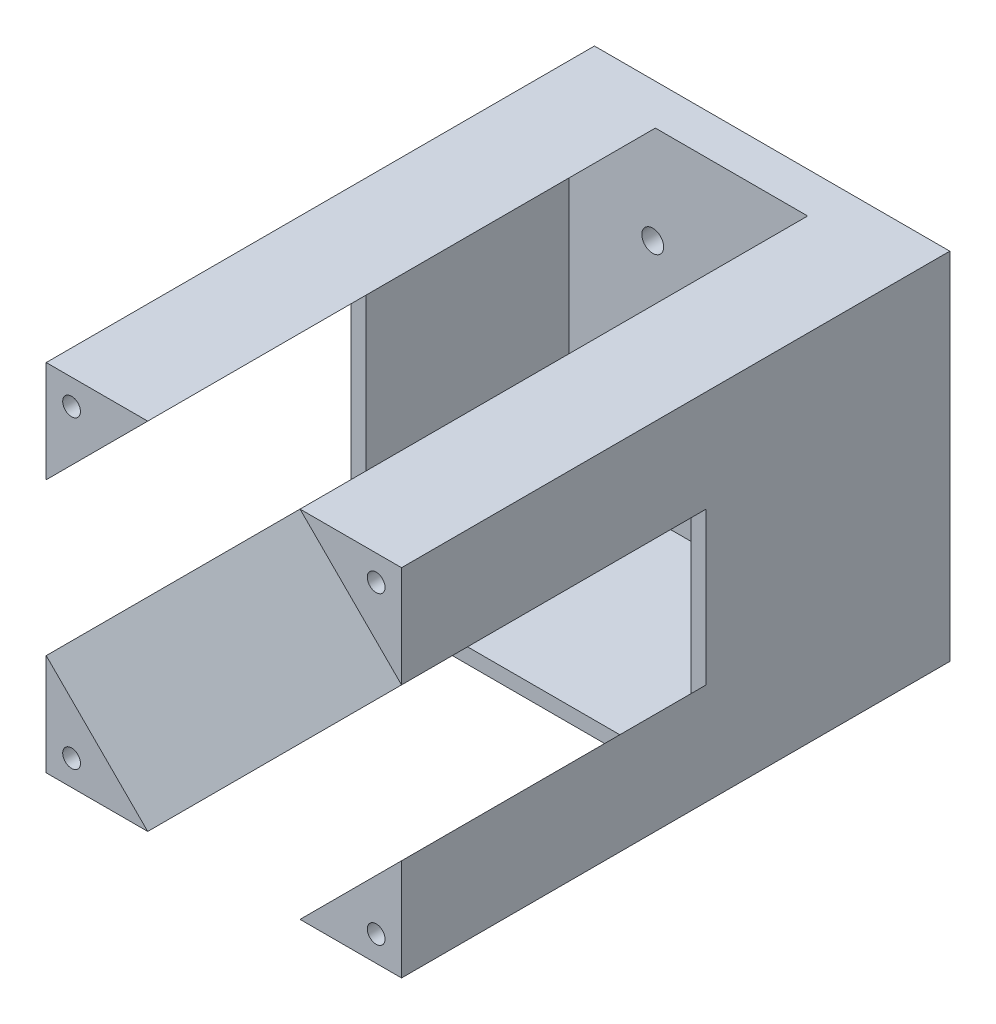
from build123d import *

# Parameters (mm, degrees)
SCHIZZO1_W                   = 70
SCHIZZO1_H                   = 70
ESTRUSIONE_ESTRUSIONE2_DEPTH = 8
FORO_PER_VITE_M6_1_D         = 6.6
FORO_PER_VITE_M6_1_DEPTH     = 10
FORO_PER_VITE_M6_1_TIP       = 1.982840043
FORO_PER_VITE_M4_1_D         = 4.3
ESTRUSIONE_ESTRUSIONE5_DEPTH = 100
FORO_0_15_3_5_1_D            = 3.5
FORO_0_15_3_5_1_DEPTH        = 15
TAGLIO_ESTRUSIONE2_DEPTH     = 2.6
RIPETIZIONECIRCOLARE28_COUNT = 4
SCHIZZO29_W                  = 38
SCHIZZO29_H                  = 40
ESTRUSIONE_ESTRUSIONE9_DEPTH = 3
RIPETIZIONECIRCOLARE30_COUNT = 3
RIPETIZIONECIRCOLARE30_ANGLE = 180


with BuildPart() as part:
    # Schizzo1 → Estrusione-Estrusione2 (new body)
    with BuildSketch(Plane(origin=(0, 0, 0), x_dir=(0, 1, 0), z_dir=(0, 0, 1))):
        Rectangle(SCHIZZO1_W, SCHIZZO1_H)
    extrude(amount=ESTRUSIONE_ESTRUSIONE2_DEPTH)

    # Foro per Vite M6-1
    with Locations(Plane.XY.offset(8)):
        with Locations((0, 0)):
            Hole(FORO_PER_VITE_M6_1_D / 2, depth=FORO_PER_VITE_M6_1_DEPTH)
            with Locations((0, 0, -(FORO_PER_VITE_M6_1_DEPTH + FORO_PER_VITE_M6_1_TIP / 2))):  # 118° drill point
                Cone(0, FORO_PER_VITE_M6_1_D / 2, FORO_PER_VITE_M6_1_TIP, mode=Mode.SUBTRACT)

    # Foro per Vite M4-1 (through all)
    with Locations(Plane.XY.offset(8)):
        with Locations((0, 0), (15.52, 15.52), (-15.52, -15.52), (-15.52, 15.52), (15.52, -15.52)):
            Hole(FORO_PER_VITE_M4_1_D / 2)

    # Schizzo20 → Estrusione-Estrusione5 (add)
    with BuildSketch(Plane.XY.offset(8)):
        Polygon((-35, 35), (-35, 15), (-15, 35), align=None)
    estrusione_estrusione5 = extrude(amount=ESTRUSIONE_ESTRUSIONE5_DEPTH)

    # Foro Ø0.15 (3.5)-1
    with Locations(Plane.XY.offset(108)):
        with Locations((-30, 30)):
            foro_0_15_3_5_1 = Hole(FORO_0_15_3_5_1_D / 2, depth=FORO_0_15_3_5_1_DEPTH)

    # Schizzo24 → Taglio-Estrusione2 (cut)
    with BuildSketch(Plane.XY.offset(105)):
        Polygon((-26.824573519, 30), (-28.41228676, 32.75), (-31.58771324, 32.75), (-33.175426481, 30), (-31.58771324, 27.25), (-28.41228676, 27.25), align=None)
    taglio_estrusione2 = extrude(amount=-TAGLIO_ESTRUSIONE2_DEPTH, mode=Mode.SUBTRACT)

    # RipetizioneCircolare28: Estrusione-Estrusione5, Foro Ø0.15 (3.5)-1, Taglio-Estrusione2 ×4 about axis
    ripetizionecircolare28_axis = Axis((0, 0, 8), (0, 0, 1))
    add([estrusione_estrusione5.rotate(ripetizionecircolare28_axis, i * 360 / RIPETIZIONECIRCOLARE28_COUNT) for i in range(1, RIPETIZIONECIRCOLARE28_COUNT)])
    add([foro_0_15_3_5_1.rotate(ripetizionecircolare28_axis, i * 360 / RIPETIZIONECIRCOLARE28_COUNT) for i in range(1, RIPETIZIONECIRCOLARE28_COUNT)], mode=Mode.SUBTRACT)
    add([taglio_estrusione2.rotate(ripetizionecircolare28_axis, i * 360 / RIPETIZIONECIRCOLARE28_COUNT) for i in range(1, RIPETIZIONECIRCOLARE28_COUNT)], mode=Mode.SUBTRACT)

    # Schizzo29 → Estrusione-Estrusione9 (add)
    with BuildSketch(Plane(origin=(-35, 0, 0), x_dir=(0, -1, 0), z_dir=(-1, 0, 0))):
        with Locations((0, 28)):
            Rectangle(SCHIZZO29_W, SCHIZZO29_H)
    estrusione_estrusione9 = extrude(amount=-ESTRUSIONE_ESTRUSIONE9_DEPTH)

    # RipetizioneCircolare30: Estrusione-Estrusione9 ×3 about axis
    ripetizionecircolare30_axis = Axis((0, 0, 8), (0, 0, 1))
    for i in range(1, RIPETIZIONECIRCOLARE30_COUNT):
        add(estrusione_estrusione9.rotate(ripetizionecircolare30_axis, i * RIPETIZIONECIRCOLARE30_ANGLE / (RIPETIZIONECIRCOLARE30_COUNT - 1)))


solid = part.part
